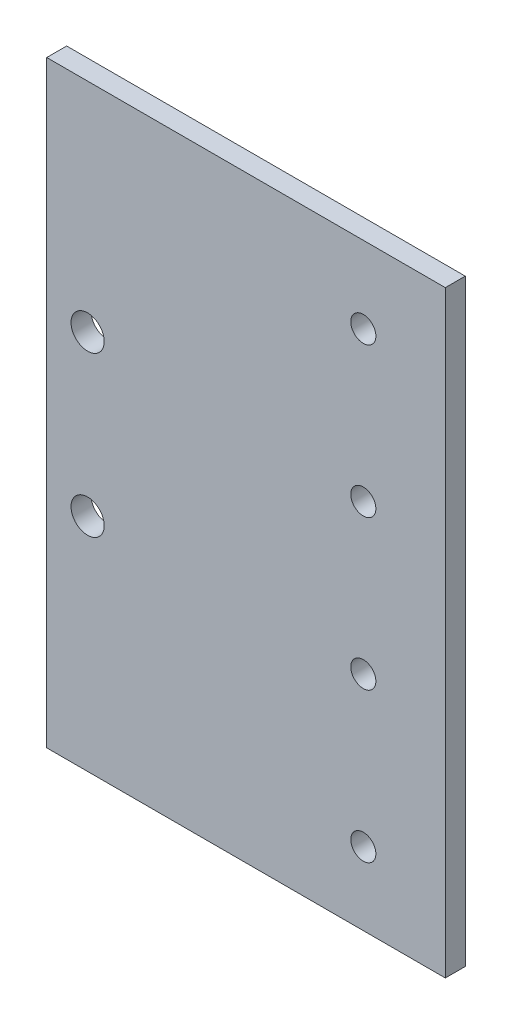
from build123d import *

# Parameters (mm, degrees)
SKETCH2_W           = 100
SKETCH2_H           = 150
BOSS_EXTRUDE1_DEPTH = 5
SKETCH3_R           = 4.165
SKETCH3_R_2         = 3.15
CUT_EXTRUDE1_DEPTH  = 5


with BuildPart() as part:
    # Sketch2 → Boss-Extrude1 (new body)
    with BuildSketch(Plane.XY):
        with Locations((-173.010889244, -74.49468588)):
            Rectangle(SKETCH2_W, SKETCH2_H)
    extrude(amount=BOSS_EXTRUDE1_DEPTH)

    # Sketch3 → Cut-Extrude1 (cut)
    with BuildSketch(Plane(origin=(0, 0, 0), x_dir=(-1, 0, 0), z_dir=(0, 0, -1))):
        with Locations((212.756022811, -54.012878845)):
            Circle(SKETCH3_R)
        with Locations((212.756022811, -94.012878845)):
            Circle(SKETCH3_R)
        with Locations((143.584758496, -18.75)):
            Circle(SKETCH3_R_2)
        with Locations((143.584758496, -56.25)):
            Circle(SKETCH3_R_2)
        with Locations((143.584758496, -93.75)):
            Circle(SKETCH3_R_2)
        with Locations((143.584758496, -131.25)):
            Circle(SKETCH3_R_2)
    extrude(amount=-CUT_EXTRUDE1_DEPTH, mode=Mode.SUBTRACT)


solid = part.part
